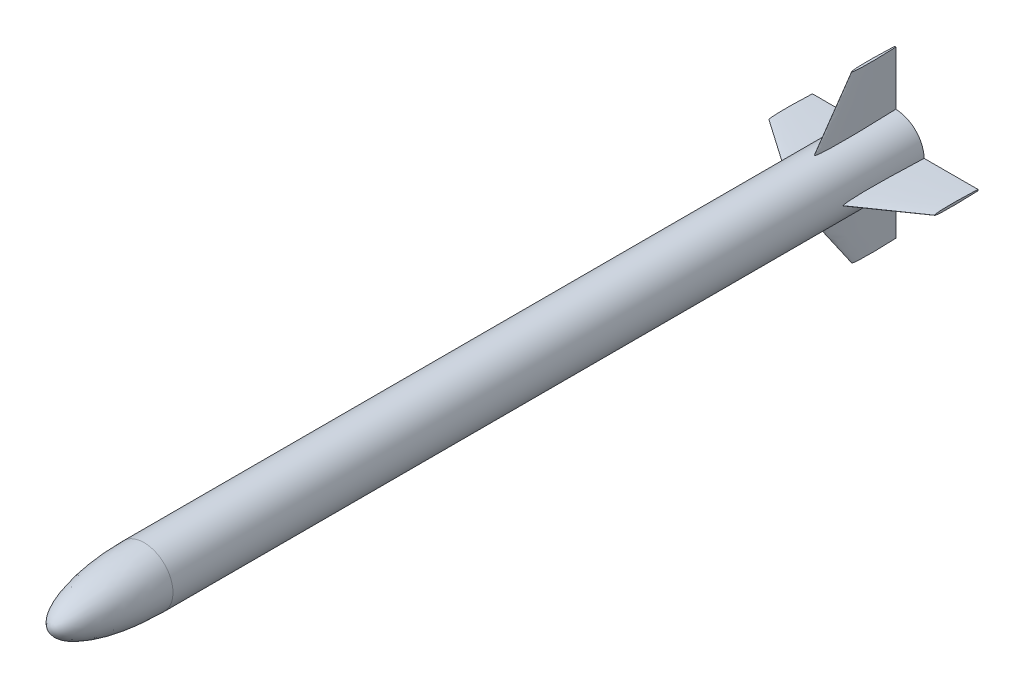
from build123d import *

# Parameters (mm, degrees)
SKETCH3_R                = 43.942
BOSS_EXTRUDE1_DEPTH      = 15.24
BOSS_EXTRUDE2_REACH      = 2331.885
BOSS_EXTRUDE2_END_RADIUS = 78.322932
SKETCH4_W                = 3.175
SKETCH4_H                = 203.2
CUT_EXTRUDE1_REACH       = 2322.063
SKETCH8_W                = 7.50506191
SKETCH8_H                = 49.98646483
CUT_EXTRUDE3_DEPTH       = 2331.674814102
CIRPATTERN1_COUNT        = 4


with BuildPart() as part:
    # Sketch2 → Revolve1 (revolve)
    with BuildSketch(Plane(origin=(0, 0, 0), x_dir=(0, 0, -1), z_dir=(1, 0, 0))):
        with BuildLine():
            Line((254, 78.322932), (2289.4925, 78.322932))
            Line((2289.4925, 78.322932), (2289.4925, 0))
            Line((2289.4925, 0), (0, 0))
            add(Edge.make_bspline(
                [(254, 78.322932), (0, 78.322932), (0, 0)],
                knots=[4.71238898, 4.71238898, 4.71238898, 6.283185307, 6.283185307, 6.283185307], degree=2, weights=[1, 0.707106781, 1]))
        make_face()
    revolve(axis=Axis((0, 0, -2289.4925), (0, 0, 1)))

    # Sketch3 → Boss-Extrude1 (add)
    with BuildSketch(Plane(origin=(0, 0, -2289.4925), x_dir=(-1, 0, 0), z_dir=(0, 0, -1))):
        Circle(SKETCH3_R)
    extrude(amount=BOSS_EXTRUDE1_DEPTH)

    # Boss-Extrude2: up to this cylinder (the profile starts outside it)
    boss_extrude2_end = Plane(origin=(0, 0, -2184.7175), z_dir=(0, 0, -1)) * Cylinder(BOSS_EXTRUDE2_END_RADIUS, 4821.415864, mode=Mode.PRIVATE)
    # Sketch4 → Boss-Extrude2 (add, up to the surface)
    with BuildSketch(Plane(origin=(0, 254, 0), x_dir=(1, 0, 0), z_dir=(0, 1, 0)), mode=Mode.PRIVATE) as boss_extrude2_sk1:
        with Locations((0, 2184.7175)):
            Rectangle(SKETCH4_W, SKETCH4_H)
    boss_extrude2_tool1 = extrude(boss_extrude2_sk1.sketch, amount=-BOSS_EXTRUDE2_REACH, mode=Mode.PRIVATE) - boss_extrude2_end
    boss_extrude2 = boss_extrude2_tool1.solids().sort_by_distance((0, 254, -2184.7175))[0]
    add(boss_extrude2)

    # Sketch5 → Cut-Extrude1 (cut, up to next)
    with BuildSketch(Plane.ZY.offset(1.5875), mode=Mode.PRIVATE) as cut_extrude1_sk1:
        Polygon((-2286.3175, 224.356842107), (-2184.7175, 224.356842107), (-2083.1175, 78.306842107), (-2083.1175, 254), (-2286.3175, 254), align=None)
    cut_extrude1_tool1 = extrude(cut_extrude1_sk1.sketch, amount=-CUT_EXTRUDE1_REACH, mode=Mode.PRIVATE) & part.part
    cut_extrude1 = cut_extrude1_tool1.solids().sort_by_distance((-1.5875, 204.128915, -2147.334252))[0]
    add(cut_extrude1, mode=Mode.SUBTRACT)

    # Sketch6 → Loft12 section 0
    with BuildSketch(Plane(origin=(0, 224.356842107, 0), x_dir=(1, 0, 0), z_dir=(0, 1, 0))):
        with BuildLine():
            add(Edge.make_bspline(
                [(0, 2171.7), (0.051023025, 2171.700648282), (0.123073762, 2171.713903143), (0.20868098, 2171.754165542), (0.306157837, 2171.828428146), (0.38077584, 2171.901401687), (0.459239223, 2171.995621491), (0.552747398, 2172.131901904), (0.67112201, 2172.341534489), (0.836676052, 2172.705674314), (1.091383201, 2173.433960229), (1.386540708, 2174.608089462), (1.683612322, 2176.186719151), (2.047714994, 2178.689894638), (2.395674972, 2181.901770917), (2.843561273, 2187.452013643), (3.233815395, 2195.347274659), (3.484465724, 2204.973743405), (3.565733066, 2216.324694259), (3.497304061, 2227.678560982), (3.316930215, 2239.026317509), (3.050599853, 2250.380330588), (2.758835231, 2260.300803769), (2.473165566, 2268.822634779), (2.164545402, 2277.309451419), (1.884603368, 2284.442277183), (1.592982913, 2291.455089252), (1.272905783, 2298.655354604), (1.021298601, 2304.13369712), (0.728615668, 2310.150742323), (0.476201594, 2315.218638113), (0.210201711, 2320.23896901), (0.070930363, 2322.811698128), (0, 2324.100018296)],
                knots=[0, 0, 0, 0, 0, 0.001188773, 0.001744604, 0.002211261, 0.002902454, 0.003665217, 0.004655039, 0.006134761, 0.008618592, 0.013161868, 0.022971681, 0.034880856, 0.046790031, 0.073273565, 0.0997571, 0.167217454, 0.23467781, 0.302138166, 0.369598523, 0.437058879, 0.504519235, 0.571979591, 0.60570977, 0.639439948, 0.706900304, 0.740630482, 0.77436066, 0.808090839, 0.841821017, 0.875551195, 0.909281373, 0.909281373, 0.909281373, 0.909281373, 0.909281373], degree=4))
            add(Edge.make_bspline(
                [(0, 2171.7), (-0.051023025, 2171.700648282), (-0.123073762, 2171.713903143), (-0.20868098, 2171.754165542), (-0.306157837, 2171.828428146), (-0.38077584, 2171.901401687), (-0.459239223, 2171.995621491), (-0.552747398, 2172.131901904), (-0.67112201, 2172.341534489), (-0.836676052, 2172.705674314), (-1.091383201, 2173.433960229), (-1.386540708, 2174.608089462), (-1.683612322, 2176.186719151), (-2.047714994, 2178.689894638), (-2.395674972, 2181.901770917), (-2.843561273, 2187.452013643), (-3.233815395, 2195.347274659), (-3.484465724, 2204.973743405), (-3.565733066, 2216.324694259), (-3.497304061, 2227.678560982), (-3.316930215, 2239.026317509), (-3.050599853, 2250.380330588), (-2.758835231, 2260.300803769), (-2.473165566, 2268.822634779), (-2.164545402, 2277.309451419), (-1.884603368, 2284.442277183), (-1.592982913, 2291.455089252), (-1.272905783, 2298.655354604), (-1.021298601, 2304.13369712), (-0.728615668, 2310.150742323), (-0.476201594, 2315.218638113), (-0.210201711, 2320.238969009), (-0.070930363, 2322.811698128), (0, 2324.100018296)],
                knots=[0, 0, 0, 0, 0, 0.001188773, 0.001744604, 0.002211261, 0.002902454, 0.003665217, 0.004655039, 0.006134761, 0.008618592, 0.013161868, 0.022971681, 0.034880856, 0.046790031, 0.073273565, 0.0997571, 0.167217454, 0.23467781, 0.302138166, 0.369598523, 0.437058879, 0.504519235, 0.571979591, 0.60570977, 0.639439948, 0.706900304, 0.740630482, 0.77436066, 0.808090839, 0.841821017, 0.875551195, 0.909281373, 0.909281373, 0.909281373, 0.909281373, 0.909281373], degree=4))
        make_face()
    # Sketch7 → Loft12 section 1
    with BuildSketch(Plane(origin=(0, 78.105, 0), x_dir=(1, 0, 0), z_dir=(0, 1, 0))):
        with BuildLine():
            add(Edge.make_bspline(
                [(0, 2070.1), (0.034219924, 2070.100165249), (0.101433103, 2070.107349373), (0.231578713, 2070.150196993), (0.360328489, 2070.246951985), (0.462507028, 2070.353564142), (0.561959786, 2070.481012431), (0.644614931, 2070.603175552), (0.750526321, 2070.78519167), (0.892167773, 2071.074452021), (1.083903907, 2071.549787837), (1.369429879, 2072.438060657), (1.816145557, 2074.293717739), (2.298808701, 2077.180168637), (2.769987399, 2080.990528328), (3.296814895, 2086.604968322), (3.769686564, 2093.440016864), (4.283475655, 2103.673053012), (4.695953859, 2117.307852477), (4.924993808, 2133.219867535), (4.949672088, 2151.407398455), (4.801833129, 2169.593016337), (4.556982302, 2185.505734367), (4.283038202, 2199.141404202), (3.964939404, 2212.780562475), (3.667273138, 2224.137774842), (3.340204516, 2235.509585415), (2.988306879, 2246.856607416), (2.690431026, 2255.967845223), (2.303497954, 2267.285895323), (1.805042261, 2280.999071732), (1.282003917, 2294.482999268), (0.752405736, 2307.183955871), (0.368402997, 2315.97815155), (0.142501679, 2320.98629114), (0.04750229, 2323.067612156), (0, 2324.100021297)],
                knots=[0, 0, 0, 0, 0, 0.000482574, 0.000965149, 0.001930298, 0.002260301, 0.002590304, 0.003269978, 0.004035031, 0.005264177, 0.007184719, 0.010581715, 0.017344383, 0.032491444, 0.048939298, 0.065387151, 0.097842867, 0.130298584, 0.19521002, 0.260121457, 0.325032894, 0.389944331, 0.454855768, 0.487311487, 0.519767205, 0.584678642, 0.617134361, 0.649590079, 0.682045798, 0.714501516, 0.779412953, 0.84432439, 0.876780109, 0.893007968, 0.909235827, 0.909235827, 0.909235827, 0.909235827, 0.909235827], degree=4))
            add(Edge.make_bspline(
                [(0, 2070.1), (-0.034219924, 2070.100165249), (-0.101433103, 2070.107349373), (-0.231578713, 2070.150196993), (-0.360328489, 2070.246951985), (-0.462507028, 2070.353564142), (-0.561959786, 2070.481012431), (-0.644614931, 2070.603175552), (-0.750526321, 2070.78519167), (-0.892167773, 2071.074452021), (-1.083903907, 2071.549787837), (-1.369429879, 2072.438060657), (-1.816145557, 2074.293717739), (-2.298808701, 2077.180168637), (-2.769987399, 2080.990528328), (-3.296814895, 2086.604968322), (-3.769686564, 2093.440016864), (-4.283475655, 2103.673053012), (-4.695953859, 2117.307852477), (-4.924993808, 2133.219867535), (-4.949672088, 2151.407398455), (-4.801833129, 2169.593016337), (-4.556982302, 2185.505734367), (-4.283038202, 2199.141404202), (-3.964939404, 2212.780562475), (-3.667273138, 2224.137774842), (-3.340204516, 2235.509585415), (-2.988306879, 2246.856607416), (-2.690431026, 2255.967845223), (-2.303497954, 2267.285895323), (-1.805042261, 2280.999071732), (-1.282003917, 2294.482999268), (-0.752405736, 2307.183955871), (-0.368402997, 2315.97815155), (-0.142501679, 2320.98629114), (-0.04750229, 2323.067612156), (0, 2324.100021297)],
                knots=[0, 0, 0, 0, 0, 0.000482574, 0.000965149, 0.001930298, 0.002260301, 0.002590304, 0.003269978, 0.004035031, 0.005264177, 0.007184719, 0.010581715, 0.017344383, 0.032491444, 0.048939298, 0.065387151, 0.097842867, 0.130298584, 0.19521002, 0.260121457, 0.325032894, 0.389944331, 0.454855768, 0.487311487, 0.519767205, 0.584678642, 0.617134361, 0.649590079, 0.682045798, 0.714501516, 0.779412953, 0.84432439, 0.876780109, 0.893007968, 0.909235827, 0.909235827, 0.909235827, 0.909235827, 0.909235827], degree=4))
        make_face()
    loft12 = loft()

    # Sketch8 → Cut-Extrude3 (cut, through all)
    with BuildSketch(Plane.XZ.offset(-78.105)):
        with Locations((-1.209951309, -2314.485732415)):
            Rectangle(SKETCH8_W, SKETCH8_H)
    cut_extrude3 = extrude(amount=-CUT_EXTRUDE3_DEPTH, mode=Mode.SUBTRACT)

    # CirPattern1: Boss-Extrude2, Cut-Extrude1, Loft12, Cut-Extrude3 ×4 about axis
    cirpattern1_axis = Axis((0, 0, -2289.4925), (0, 0, -1))
    add([boss_extrude2.rotate(cirpattern1_axis, i * 360 / CIRPATTERN1_COUNT) for i in range(1, CIRPATTERN1_COUNT)])
    add([cut_extrude1.rotate(cirpattern1_axis, i * 360 / CIRPATTERN1_COUNT) for i in range(1, CIRPATTERN1_COUNT)], mode=Mode.SUBTRACT)
    add([loft12.rotate(cirpattern1_axis, i * 360 / CIRPATTERN1_COUNT) for i in range(1, CIRPATTERN1_COUNT)])
    add([cut_extrude3.rotate(cirpattern1_axis, i * 360 / CIRPATTERN1_COUNT) for i in range(1, CIRPATTERN1_COUNT)], mode=Mode.SUBTRACT)


solid = part.part
